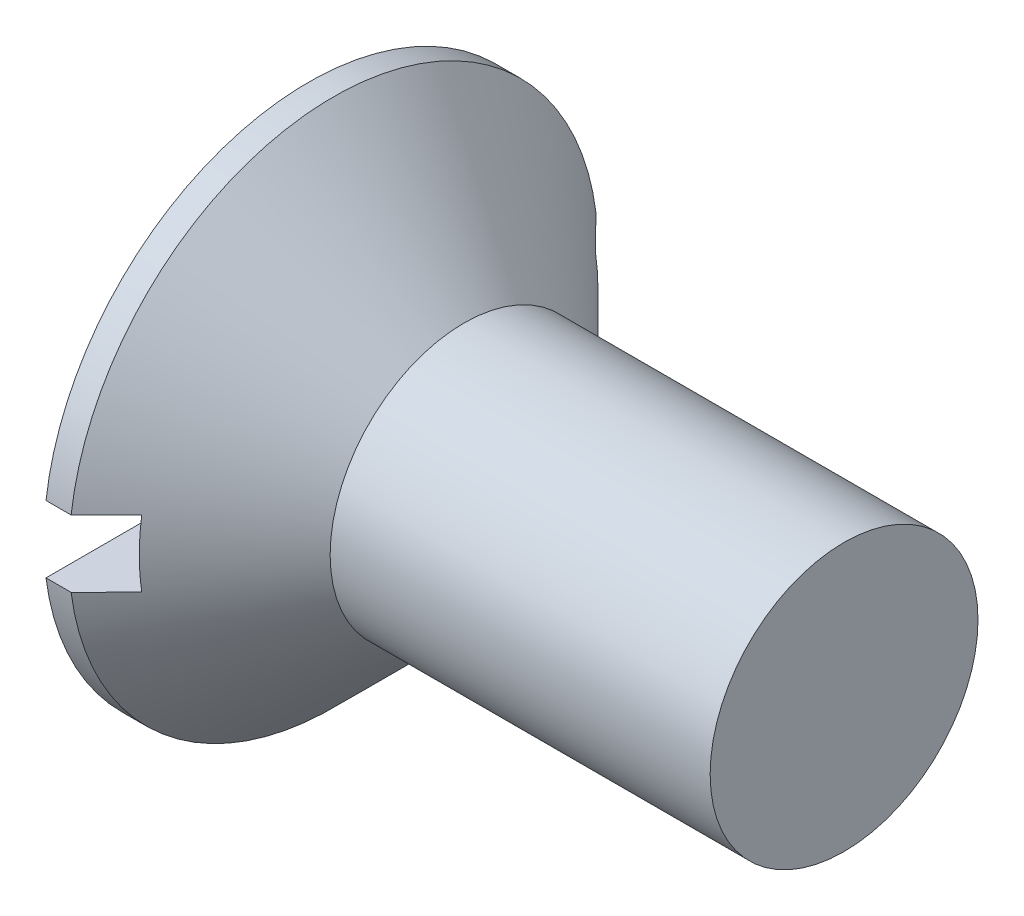
from build123d import *

# Parameters (mm, degrees)
CUT_EXTRUDE_1_DEPTH      = 20.514609912
CUT_EXTRUDE_1_DEPTH_BACK = 20.514609912
SKETCH_2_W               = 2.289640131
SKETCH_2_H               = 2


with BuildPart() as part:
    # 草图1 → 旋转1 (revolve)
    with BuildSketch(Plane.XY):
        Polygon((0, 0), (0, 7.9), (0.75, 7.9), (4.65, 4), (16, 4), (16, 0), align=None)
    revolve(axis=Axis((-3.228581577, 0, 0), (1, 0, 0)))

    # 草图2 → 切除-拉伸1 (cut, two sides: drawn at the far end of the back side and taken through both)
    with BuildSketch(Plane.XY.offset(-CUT_EXTRUDE_1_DEPTH_BACK)):
        with Locations((0.655179935, 0)):
            Rectangle(SKETCH_2_W, SKETCH_2_H)
    extrude(amount=CUT_EXTRUDE_1_DEPTH + CUT_EXTRUDE_1_DEPTH_BACK, mode=Mode.SUBTRACT)


solid = part.part
